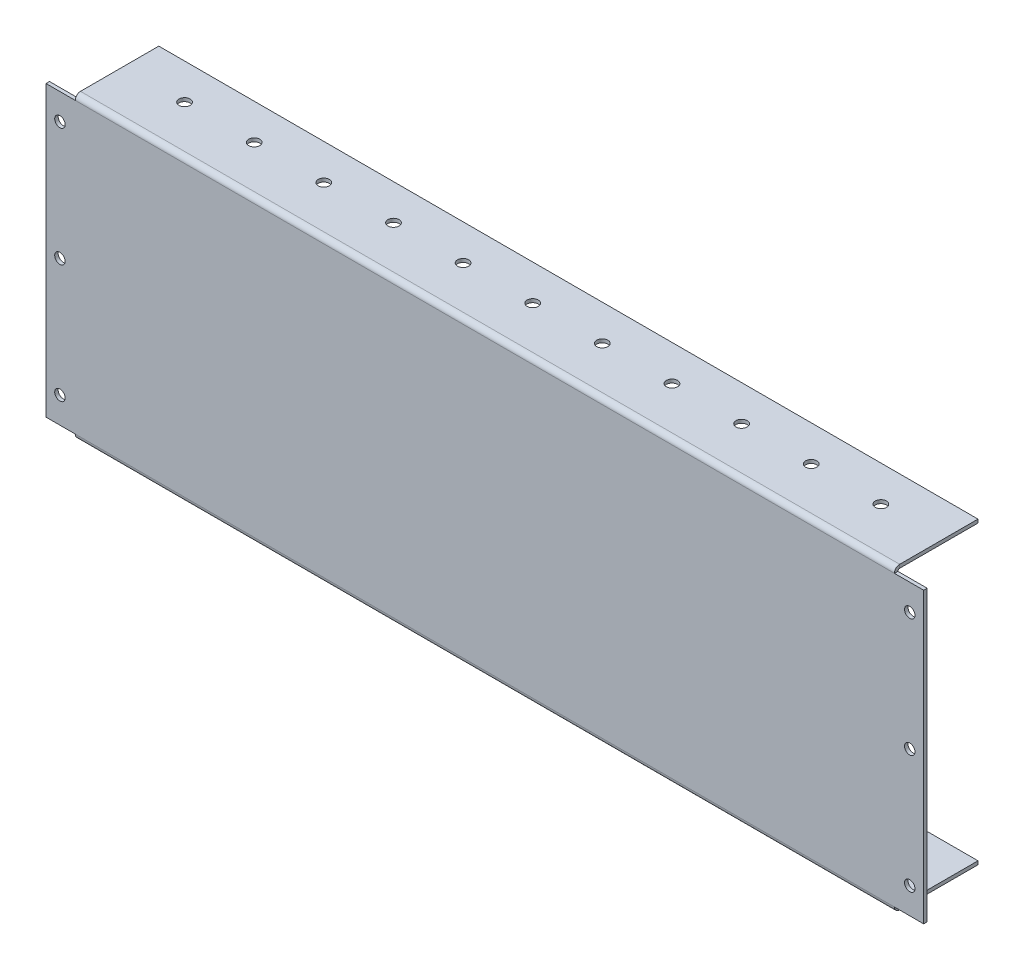
from build123d import *

# Parameters (mm, degrees)
MODEL_W                        = 252.1
MODEL_H                        = 84
MODEL_R                        = 1.5
BASE_FLANGE1_DEPTH             = 1
EDGE_FLANGE1_STRIP_W           = 5
EDGE_FLANGE1_STRIP_H           = 1
EDGE_FLANGE1_STRIP_CUT_DEPTH   = 252.1
EDGE_FLANGE1_STRIP_2_W         = 5
EDGE_FLANGE1_STRIP_2_H         = 1
EDGE_FLANGE1_STRIP_CUT_2_DEPTH = 252.1
EDGE_FLANGE1_DEPTH             = 252.1
EDGE_FLANGE1_BEND_DEPTH        = 252.1
SKETCH13_R                     = 1.6
CUT_EXTRUDE1_DEPTH             = 155.468775162
SKETCH14_W                     = 8.4
SKETCH14_H                     = 24
CUT_EXTRUDE2_DEPTH             = 1.5


# Sheet-metal steps are written as plain solids
with BuildPart() as part:
    # Model → Base-Flange1 (new body)
    with BuildSketch(Plane.XY):
        Rectangle(MODEL_W, MODEL_H)
        with Locations((-122.05, 34)):
            Circle(MODEL_R, mode=Mode.SUBTRACT)
        with Locations((-122.05, -34)):
            Circle(MODEL_R, mode=Mode.SUBTRACT)
        with Locations((122.05, -34)):
            Circle(MODEL_R, mode=Mode.SUBTRACT)
        with Locations((122.05, 34)):
            Circle(MODEL_R, mode=Mode.SUBTRACT)
        with Locations((122.05, 0)):
            Circle(MODEL_R, mode=Mode.SUBTRACT)
        with Locations((-122.05, 0)):
            Circle(MODEL_R, mode=Mode.SUBTRACT)
    extrude(amount=-BASE_FLANGE1_DEPTH)

    # Edge-Flange1 strip (across the edge) → Edge-Flange1 strip cut (cut)
    with BuildSketch(Plane(origin=(126.05, -42, -1), x_dir=(0, 1, 0), z_dir=(-1, 0, 0))):
        with Locations((-2, -0.5)):
            Rectangle(EDGE_FLANGE1_STRIP_W, EDGE_FLANGE1_STRIP_H)
    extrude(amount=EDGE_FLANGE1_STRIP_CUT_DEPTH, mode=Mode.SUBTRACT)

    # Edge-Flange1 strip 2 (across the edge) → Edge-Flange1 strip cut 2 (cut)
    with BuildSketch(Plane(origin=(-126.05, 42, -1), x_dir=(0, -1, 0), z_dir=(1, 0, 0))):
        with Locations((-2, -0.5)):
            Rectangle(EDGE_FLANGE1_STRIP_2_W, EDGE_FLANGE1_STRIP_2_H)
    extrude(amount=EDGE_FLANGE1_STRIP_CUT_2_DEPTH, mode=Mode.SUBTRACT)

    # Edge-Flange1 section (across the edge) → Edge-Flange1 (add)
    with BuildSketch(Plane(origin=(126.05, -42, -1), x_dir=(0, 1, 0), z_dir=(-1, 0, 0))):
        with BuildLine():
            Line((-1, 0.5), (-1, 23))
            Line((-1, 23), (0, 23))
            Line((0, 23), (0, 0.5))
            ThreePointArc((0, 0.5), (0.146446609, 0.146446609), (0.5, 0))
            Line((0.5, 0), (0.5, -1))
            ThreePointArc((0.5, -1), (-0.560660172, -0.560660172), (-1, 0.5))
        make_face()
    extrude(amount=EDGE_FLANGE1_DEPTH)

    # Edge-Flange1 section 2 (across the edge) → Edge-Flange1 bend (add)
    with BuildSketch(Plane(origin=(-126.05, 42, -1), x_dir=(0, -1, 0), z_dir=(1, 0, 0))):
        with BuildLine():
            Line((-1, 0.5), (-1, 23))
            Line((-1, 23), (0, 23))
            Line((0, 23), (0, 0.5))
            ThreePointArc((0, 0.5), (0.146446609, 0.146446609), (0.5, 0))
            Line((0.5, 0), (0.5, -1))
            ThreePointArc((0.5, -1), (-0.560660172, -0.560660172), (-1, 0.5))
        make_face()
    extrude(amount=EDGE_FLANGE1_BEND_DEPTH)

    # Sketch13 → Cut-Extrude1 (cut, through all)
    with BuildSketch(Plane(origin=(0, 43, 0), x_dir=(1, 0, 0), z_dir=(0, 1, 0))):
        with Locations(Location((-100, 13.75, 0), (0, 0, 270))):
            Circle(SKETCH13_R)
        with Locations(Location((-80, 13.75, 0), (0, 0, 270))):
            Circle(SKETCH13_R)
        with Locations(Location((-60, 13.75, 0), (0, 0, 270))):
            Circle(SKETCH13_R)
        with Locations(Location((-40, 13.75, 0), (0, 0, 270))):
            Circle(SKETCH13_R)
        with Locations(Location((-20, 13.75, 0), (0, 0, 270))):
            Circle(SKETCH13_R)
        with Locations(Location((0, 13.75, 0), (0, 0, 270))):
            Circle(SKETCH13_R)
        with Locations(Location((20, 13.75, 0), (0, 0, 270))):
            Circle(SKETCH13_R)
        with Locations(Location((40, 13.75, 0), (0, 0, 270))):
            Circle(SKETCH13_R)
        with Locations(Location((60, 13.75, 0), (0, 0, 270))):
            Circle(SKETCH13_R)
        with Locations(Location((80, 13.75, 0), (0, 0, 270))):
            Circle(SKETCH13_R)
        with Locations(Location((100, 13.75, 0), (0, 0, 270))):
            Circle(SKETCH13_R)
    extrude(amount=-CUT_EXTRUDE1_DEPTH, mode=Mode.SUBTRACT)

    # Sketch14 → Cut-Extrude2 (cut)
    with BuildSketch(Plane(origin=(0, 43, 0), x_dir=(1, 0, 0), z_dir=(0, 1, 0))):
        with Locations((-121.85, 12)):
            Rectangle(SKETCH14_W, SKETCH14_H)
        with Locations((121.85, 12)):
            Rectangle(SKETCH14_W, SKETCH14_H)
    cut_extrude2 = extrude(amount=-CUT_EXTRUDE2_DEPTH, mode=Mode.SUBTRACT)

    # Mirror1: Cut-Extrude2 across plane
    add(cut_extrude2.mirror(Plane.ZX), mode=Mode.SUBTRACT)


solid = part.part
